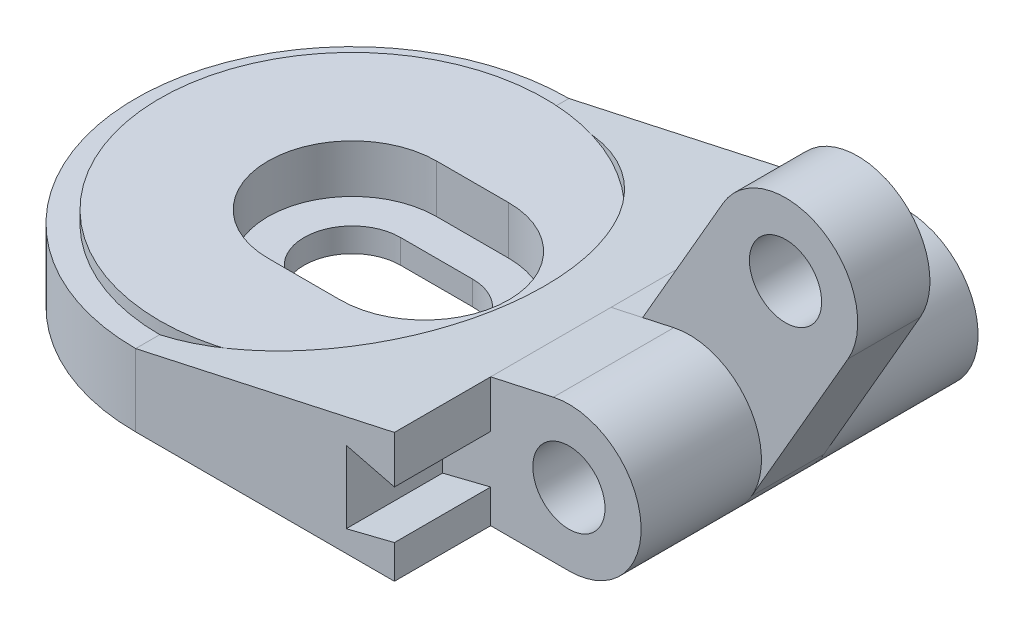
from build123d import *

# Parameters (mm, degrees)
SKETCH1_R               = 9
BOSS_EXTRUDE1_DEPTH     = 3
BOSS_EXTRUDE2_START     = -9
BOSS_EXTRUDE2_DEPTH     = 18
SKETCH5_R               = 8
CUT_EXTRUDE3_DEPTH      = 2.5
SKETCH6_R               = 6
CUT_EXTRUDE4_DEPTH      = 2.5
FILLET3_R               = 0.5
CUT_EXTRUDE5_DEPTH      = 4
HOLE1_START             = -9
HOLE1_OUTLINE_R         = 1.5
HOLE1_DEPTH             = 14
BOSS_EXTRUDE4_DEPTH     = 3
F_3_0_MM_DOWEL_HOLES1_D = 3
SKETCH14_R              = 8
BOSS_EXTRUDE5_DEPTH     = 3
CUT_EXTRUDE6_DEPTH      = 2
CUT_EXTRUDE7_DEPTH      = 2
SPLIT1_SURFACE_1_BACK   = 38.298
SPLIT1_SURFACE_1_DEPTH  = 76.596
SPLIT1_SURFACE_2_BACK   = 38.298
SPLIT1_SURFACE_2_DEPTH  = 76.596
SPLIT2_SURFACE_3_BACK   = 38.298
SPLIT2_SURFACE_3_DEPTH  = 76.596
SPLIT2_SURFACE_4_BACK   = 38.298
SPLIT2_SURFACE_4_DEPTH  = 76.596
SPLIT3_SURFACE_5_BACK   = 38.298
SPLIT3_SURFACE_5_DEPTH  = 76.596
SPLIT3_SURFACE_6_BACK   = 38.298
SPLIT3_SURFACE_6_DEPTH  = 76.596
SPLIT4_SURFACE_7_BACK   = 38.298
SPLIT4_SURFACE_7_DEPTH  = 76.596
SPLIT4_SURFACE_8_BACK   = 38.298
SPLIT4_SURFACE_8_DEPTH  = 76.596
SPLIT5_START            = -3
SPLIT5_DEPTH            = 3
SPLIT5_2_DEPTH          = 12
SPLIT5_3_DEPTH          = 5
SPLIT5_START_2          = 5
SPLIT5_4_DEPTH          = 4


with BuildPart() as part:
    # Sketch1 → Boss-Extrude1 (new body)
    with BuildSketch(Plane(origin=(0, 0, 0), x_dir=(1, 0, 0), z_dir=(0, 1, 0))):
        with Locations(Location((0, 0, 0), (0, 0, 270))):
            Circle(SKETCH1_R)
    extrude(amount=BOSS_EXTRUDE1_DEPTH)

    # Boss-Extrude2: read off the stored shape, not the designer's step
    # Boss-Extrude2 outline → Boss-Extrude2 (add)
    with BuildSketch(Plane.XY.offset(BOSS_EXTRUDE2_START)):
        with BuildLine():
            Line((13.357142857, 5.930313071), (0, 3))
            Line((0, 3), (0, 0))
            Line((0, 0), (14, 0))
            ThreePointArc((14, 0), (16.982527386, 3.323311604), (13.357142857, 5.930313071))
        make_face()
    extrude(amount=BOSS_EXTRUDE2_DEPTH)

    # Sketch5 → Cut-Extrude3 (cut, symmetric)
    with BuildSketch(Plane(origin=(0, 3, 0), x_dir=(1, 0, 0), z_dir=(0, 1, 0))):
        with Locations(Location((0, 0, 0), (0, 0, 270))):
            Circle(SKETCH5_R)
    extrude(amount=CUT_EXTRUDE3_DEPTH, both=True, mode=Mode.SUBTRACT)

    # Sketch6 → Cut-Extrude4 (cut, symmetric)
    with BuildSketch(Plane(origin=(0, 0.5, 0), x_dir=(1, 0, 0), z_dir=(0, 1, 0))):
        with Locations(Location((0, 0, 0), (0, 0, 270))):
            Circle(SKETCH6_R)
    extrude(amount=CUT_EXTRUDE4_DEPTH, both=True, mode=Mode.SUBTRACT)

    # Fillet3
    fillet3_edges = [part.edges().sort_by_distance(p)[0] for p in [
        (0, 0.5, -8),
    ]]
    fillet(fillet3_edges, radius=FILLET3_R)

    # Sketch7 → Cut-Extrude5 (cut)
    with BuildSketch(Plane(origin=(0, 0, 9), x_dir=(-1, 0, 0), z_dir=(0, 0, -1))):
        Polygon((-10.75, -52.569250145), (-10.75, -0.796086747), (-10.75, 6.228178627), (-10.75, 58.001342025), (-114.296326796, 58.001342025), (-114.296326796, -52.569250145), align=None)
    extrude(amount=CUT_EXTRUDE5_DEPTH, mode=Mode.SUBTRACT)

    # Hole1: read off the stored shape, not the designer's step
    # Hole1 outline → Hole1 (cut)
    with BuildSketch(Plane.XY.offset(HOLE1_START)):
        with Locations((14, 3)):
            Circle(HOLE1_OUTLINE_R)
    extrude(amount=HOLE1_DEPTH, mode=Mode.SUBTRACT)

    # Sketch9 → Boss-Extrude4 (add)
    with BuildSketch(Plane(origin=(0, 0, -3), x_dir=(-1, 0, 0), z_dir=(0, 0, -1))):
        with BuildLine():
            Line((-20.598076211, 8.42820323), (-16.598076211, 1.5))
            ThreePointArc((-16.598076211, 1.5), (-16.421288681, 4.771259756), (-13.357142857, 5.930313071))
            Line((-13.357142857, 5.930313071), (-12.063915065, 5.646602524))
            Line((-12.063915065, 5.646602524), (-15.401923789, 11.42820323))
            ThreePointArc((-15.401923789, 11.42820323), (-19.5, 12.526279442), (-20.598076211, 8.42820323))
        make_face()
    extrude(amount=-BOSS_EXTRUDE4_DEPTH)

    # Ø3.0 mm Dowel Holes1 (through all)
    with Locations(Plane(origin=(18, 9.92820323, -3), x_dir=(-1, 0, 0), z_dir=(0, 0, -1))):
        with Locations((0, 0)):
            Hole(F_3_0_MM_DOWEL_HOLES1_D / 2)


with BuildPart() as body_2:
    # Sketch14 → Boss-Extrude5 (new body)
    with BuildSketch(Plane(origin=(0, 0.5, 0), x_dir=(1, 0, 0), z_dir=(0, 1, 0))):
        with Locations(Location((0, 0, 0), (0, 0, 270))):
            Circle(SKETCH14_R)
    extrude(amount=BOSS_EXTRUDE5_DEPTH)

    # Sketch15 → Cut-Extrude6 (cut)
    with BuildSketch(Plane(origin=(0, 3.5, 0), x_dir=(1, 0, 0), z_dir=(0, 1, 0))):
        with BuildLine():
            Line((0, 3.5), (3, 3.5))
            ThreePointArc((3, 3.5), (6.5, 0), (3, -3.5))
            Line((3, -3.5), (0, -3.5))
            ThreePointArc((0, -3.5), (-3.5, 0), (0, 3.5))
        make_face()
    extrude(amount=-CUT_EXTRUDE6_DEPTH, mode=Mode.SUBTRACT)

    # Sketch17 → Cut-Extrude7 (cut)
    with BuildSketch(Plane(origin=(0, 1.5, 0), x_dir=(1, 0, 0), z_dir=(0, 1, 0))):
        with BuildLine():
            Line((0, -2), (3, -2))
            ThreePointArc((3, -2), (5, 0), (3, 2))
            Line((3, 2), (0, 2))
            ThreePointArc((0, 2), (-2, 0), (0, -2))
        make_face()
    extrude(amount=-CUT_EXTRUDE7_DEPTH, mode=Mode.SUBTRACT)


with BuildPart() as body_3:
    # Split1: the piece behind the surface
    add(part.part)
    # Split1 surface: a surface, the sketch's curves swept straight by 76.596 mm
    with BuildLine(Plane.XY.offset(9).offset(-SPLIT1_SURFACE_1_BACK), mode=Mode.PRIVATE) as split1_surface_1_path:
        Line((10.75, 7.850645476), (10.75, 3.394442709))
        Line((10.75, 3.394442709), (8.750335479, 3.894442709))
        Line((8.750335479, 3.894442709), (8.750335479, 0.894442709))
        Line((8.750335479, 0.894442709), (10.75, 1.394442709))
        Line((10.75, 1.394442709), (10.75, -1.763593227))
    split1_surface_1 = Shell.extrude(split1_surface_1_path.wire(), (0 * SPLIT1_SURFACE_1_DEPTH, 0 * SPLIT1_SURFACE_1_DEPTH, 1 * SPLIT1_SURFACE_1_DEPTH))
    split(bisect_by=split1_surface_1, keep=Keep.BOTTOM)


with BuildPart() as part_1:
    add(part.part)

    # Split1: split by a surface, the side it looks to stays
    # Split1 surface: a surface, the sketch's curves swept straight by 76.596 mm
    with BuildLine(Plane.XY.offset(9).offset(-SPLIT1_SURFACE_2_BACK), mode=Mode.PRIVATE) as split1_surface_2_path:
        Line((10.75, 7.850645476), (10.75, 3.394442709))
        Line((10.75, 3.394442709), (8.750335479, 3.894442709))
        Line((8.750335479, 3.894442709), (8.750335479, 0.894442709))
        Line((8.750335479, 0.894442709), (10.75, 1.394442709))
        Line((10.75, 1.394442709), (10.75, -1.763593227))
    split1_surface_2 = Shell.extrude(split1_surface_2_path.wire(), (0 * SPLIT1_SURFACE_2_DEPTH, 0 * SPLIT1_SURFACE_2_DEPTH, 1 * SPLIT1_SURFACE_2_DEPTH))
    split(bisect_by=split1_surface_2, keep=Keep.TOP)


with BuildPart() as body_4:
    # Split2: the piece behind the surface
    add(part_1.part)
    # Split2 surface: a surface, the sketch's curves swept straight by 76.596 mm
    with BuildLine(Plane(origin=(0, 3.5, 0), x_dir=(1, 0, 0), z_dir=(0, 1, 0)).offset(-SPLIT2_SURFACE_3_BACK), mode=Mode.PRIVATE) as split2_surface_3_path:
        Line((27.399686623, 0), (10.75, 0))
        Line((10.75, 0), (10.75, 3))
        Line((10.75, 3), (26.181796161, 3))
    split2_surface_3 = Shell.extrude(split2_surface_3_path.wire(), (0 * SPLIT2_SURFACE_3_DEPTH, 1 * SPLIT2_SURFACE_3_DEPTH, 0 * SPLIT2_SURFACE_3_DEPTH))
    split(bisect_by=split2_surface_3, keep=Keep.BOTTOM)


with BuildPart() as part_2:
    add(part_1.part)

    # Split2: split by a surface, the side it looks to stays
    # Split2 surface: a surface, the sketch's curves swept straight by 76.596 mm
    with BuildLine(Plane(origin=(0, 3.5, 0), x_dir=(1, 0, 0), z_dir=(0, 1, 0)).offset(-SPLIT2_SURFACE_4_BACK), mode=Mode.PRIVATE) as split2_surface_4_path:
        Line((27.399686623, 0), (10.75, 0))
        Line((10.75, 0), (10.75, 3))
        Line((10.75, 3), (26.181796161, 3))
    split2_surface_4 = Shell.extrude(split2_surface_4_path.wire(), (0 * SPLIT2_SURFACE_4_DEPTH, 1 * SPLIT2_SURFACE_4_DEPTH, 0 * SPLIT2_SURFACE_4_DEPTH))
    split(bisect_by=split2_surface_4, keep=Keep.TOP)


with BuildPart() as body_5:
    # Split3: the piece behind the surface
    add(part_2.part)
    # Split3 surface: a surface, the sketch's curves swept straight by 76.596 mm
    with BuildLine(Plane(origin=(0, 3.5, 0), x_dir=(1, 0, 0), z_dir=(0, 1, 0)).offset(-SPLIT3_SURFACE_5_BACK), mode=Mode.PRIVATE) as split3_surface_5_path:
        Line((10.75, 0), (24.171696764, 0))
        Line((24.171696764, 0), (24.171696764, -5))
        Line((24.171696764, -5), (10.75, -5))
        Line((10.75, -5), (10.75, 0))
    split3_surface_5 = Shell.extrude(split3_surface_5_path.wire(), (0 * SPLIT3_SURFACE_5_DEPTH, 1 * SPLIT3_SURFACE_5_DEPTH, 0 * SPLIT3_SURFACE_5_DEPTH))
    split(bisect_by=split3_surface_5, keep=Keep.BOTTOM)


with BuildPart() as part_3:
    add(part_2.part)

    # Split3: split by a surface, the side it looks to stays
    # Split3 surface: a surface, the sketch's curves swept straight by 76.596 mm
    with BuildLine(Plane(origin=(0, 3.5, 0), x_dir=(1, 0, 0), z_dir=(0, 1, 0)).offset(-SPLIT3_SURFACE_6_BACK), mode=Mode.PRIVATE) as split3_surface_6_path:
        Line((10.75, 0), (24.171696764, 0))
        Line((24.171696764, 0), (24.171696764, -5))
        Line((24.171696764, -5), (10.75, -5))
        Line((10.75, -5), (10.75, 0))
    split3_surface_6 = Shell.extrude(split3_surface_6_path.wire(), (0 * SPLIT3_SURFACE_6_DEPTH, 1 * SPLIT3_SURFACE_6_DEPTH, 0 * SPLIT3_SURFACE_6_DEPTH))
    split(bisect_by=split3_surface_6, keep=Keep.TOP)


with BuildPart() as body_6:
    # Split4: the piece behind the surface
    add(part_3.part)
    # Split4 surface: a surface, the sketch's curves swept straight by 76.596 mm
    with BuildLine(Plane.XY.offset(9).offset(-SPLIT4_SURFACE_7_BACK), mode=Mode.PRIVATE) as split4_surface_7_path:
        Line((8.750335479, 0.894442709), (10.75, 1.394442709))
        Line((10.75, 1.394442709), (10.75, 3.394442709))
        Line((10.75, 3.394442709), (8.750335479, 3.894442709))
        Line((8.750335479, 3.894442709), (8.750335479, 0.894442709))
    split4_surface_7 = Shell.extrude(split4_surface_7_path.wire(), (0 * SPLIT4_SURFACE_7_DEPTH, 0 * SPLIT4_SURFACE_7_DEPTH, 1 * SPLIT4_SURFACE_7_DEPTH))
    split(bisect_by=split4_surface_7, keep=Keep.BOTTOM)


with BuildPart() as part_4:
    add(part_3.part)

    # Split4: split by a surface, the side it looks to stays
    # Split4 surface: a surface, the sketch's curves swept straight by 76.596 mm
    with BuildLine(Plane.XY.offset(9).offset(-SPLIT4_SURFACE_8_BACK), mode=Mode.PRIVATE) as split4_surface_8_path:
        Line((8.750335479, 0.894442709), (10.75, 1.394442709))
        Line((10.75, 1.394442709), (10.75, 3.394442709))
        Line((10.75, 3.394442709), (8.750335479, 3.894442709))
        Line((8.750335479, 3.894442709), (8.750335479, 0.894442709))
    split4_surface_8 = Shell.extrude(split4_surface_8_path.wire(), (0 * SPLIT4_SURFACE_8_DEPTH, 0 * SPLIT4_SURFACE_8_DEPTH, 1 * SPLIT4_SURFACE_8_DEPTH))
    split(bisect_by=split4_surface_8, keep=Keep.TOP)

    # Split5 2 outline → Split5 2 (cut)
    with BuildSketch(Plane.XY.offset(SPLIT5_START)):
        Polygon((8.750335479, 0.894442709), (10.75, 1.394442709), (10.75, 3.394442709), (8.750335479, 3.894442709), align=None)
    extrude(amount=SPLIT5_2_DEPTH, mode=Mode.SUBTRACT)


with BuildPart() as body_7:
    # Split5: read off the stored shape, not the designer's step
    # Split5 outline → Split5 (new body)
    with BuildSketch(Plane.XY.offset(SPLIT5_START)):
        Polygon((10.75, 3.394442709), (8.750335479, 3.894442709), (8.750335479, 0.894442709), (10.75, 1.394442709), align=None)
    extrude(amount=SPLIT5_DEPTH)


with BuildPart() as body_8:
    # Split5 3 outline → Split5 3 (new body)
    with BuildSketch(Plane.XY):
        Polygon((10.75, 3.394442709), (8.750335479, 3.894442709), (8.750335479, 0.894442709), (10.75, 1.394442709), align=None)
    extrude(amount=SPLIT5_3_DEPTH)


with BuildPart() as body_9:
    # Split5 4 outline → Split5 4 (new body)
    with BuildSketch(Plane.XY.offset(SPLIT5_START_2)):
        Polygon((10.75, 3.394442709), (8.750335479, 3.894442709), (8.750335479, 0.894442709), (10.75, 1.394442709), align=None)
    extrude(amount=SPLIT5_4_DEPTH)


with BuildPart() as body_5_1:
    add(body_5.part)

    # Combine1: read off the stored shape, not the designer's step
    # Combine1: union body 8
    add(body_8.part)


with BuildPart() as body_3_1:
    add(body_3.part)

    # Combine2: read off the stored shape, not the designer's step
    # Combine2: union part, body 6
    add(part_4.part)
    add(body_6.part)


with BuildPart() as body_4_1:
    add(body_4.part)

    # Combine3: read off the stored shape, not the designer's step
    # Combine3: union body 7
    add(body_7.part)


solid = Compound([body_2.part, body_5_1.part, body_3_1.part, body_4_1.part])
